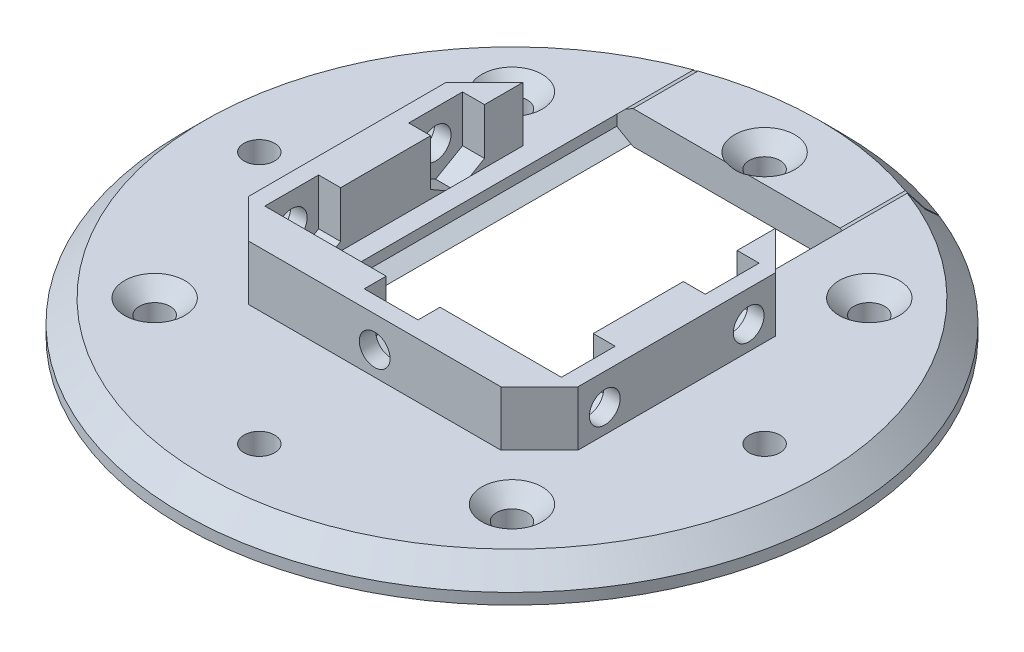
from build123d import *

# Parameters (mm, degrees)
SKETCH1_R                                      = 30
BOSS_EXTRUDE1_DEPTH                            = 1.5
CUT_EXTRUDE1_DEPTH                             = 43.532340636
BOSS_EXTRUDE2_REACH                            = 48.465
BOSS_EXTRUDE2_END_RADIUS                       = 30
CHAMFER1_SIZE                                  = 2
BOSS_EXTRUDE3_REACH                            = 60.715
BOSS_EXTRUDE3_END_RADIUS                       = 30
CHAMFER2_SIZE                                  = 2
SKETCH5_R                                      = 1.4
CUT_EXTRUDE2_DEPTH                             = 43.532340636
CSK_FOR_M2_5_FLAT_HEAD_MACHINE_SCREW1_AT_COUNT = 2
CSK_FOR_M2_5_FLAT_HEAD_MACHINE_SCREW1_AT_PITCH = 32.526911935
CSK_FOR_M2_5_FLAT_HEAD_MACHINE_SCREW_2_COUNT   = 2
CSK_FOR_M2_5_FLAT_HEAD_MACHINE_SCREW_2_PITCH   = 32.526911935
CSK_FOR_M2_5_FLAT_HEAD_MACHINE_SCREW_3_COUNT   = 2
CSK_FOR_M2_5_FLAT_HEAD_MACHINE_SCREW_3_PITCH   = 46
CSK_FOR_M2_5_FLAT_HEAD_MACHINE_SCREW_4_COUNT   = 2
CSK_FOR_M2_5_FLAT_HEAD_MACHINE_SCREW_4_PITCH   = 42.498458496
BOSS_EXTRUDE4_DEPTH                            = 5
CUT_EXTRUDE3_DEPTH                             = 2
CHAMFER3_SIZE                                  = 3.5
CUT_EXTRUDE4_DEPTH                             = 2
SKETCH13_R                                     = 1.4
CUT_EXTRUDE5_DEPTH                             = 2
CUT_EXTRUDE6_DEPTH                             = 55.472470111
CUT_EXTRUDE6_DEPTH_BACK                        = 55.472470111
SKETCH14_R                                     = 1.4


# Some blends are built 0.0001 mm under size
with BuildPart() as part:
    # Sketch1 → Boss-Extrude1 (new, symmetric)
    with BuildSketch(Plane(origin=(0, 0, 0), x_dir=(1, 0, 0), z_dir=(0, 1, 0))):
        with Locations(Location((0, 0, 0), (0, 0, 270))):
            Circle(SKETCH1_R)
    extrude(amount=BOSS_EXTRUDE1_DEPTH, both=True)

    # Sketch2 → Cut-Extrude1 (cut, through all)
    with BuildSketch(Plane(origin=(0, 1.5, 0), x_dir=(1, 0, 0), z_dir=(0, 1, 0))):
        Polygon((-11.025, 7.55), (-11.025, 30), (11.025, 30), (11.025, 7.55), (11.025, -7.55), (-11.025, -7.55), align=None)
    extrude(amount=-CUT_EXTRUDE1_DEPTH, mode=Mode.SUBTRACT)

    # Boss-Extrude2: up to this cylinder (the profile starts inside it)
    boss_extrude2_end = Plane(origin=(0, -0.7325095, 0), z_dir=(0, -1, 0)) * Cylinder(BOSS_EXTRUDE2_END_RADIUS, 159.395019, mode=Mode.PRIVATE)
    # Sketch3 → Boss-Extrude2 (add, up to the surface)
    with BuildSketch(Plane(origin=(0, 0, 7.55), x_dir=(-1, 0, 0), z_dir=(0, 0, -1)), mode=Mode.PRIVATE) as boss_extrude2_sk1:
        Polygon((-11.525, -1.5), (-9.725961894, -1.5), (-11.025, -0.75), (-11.025, 0.75), (-9.725961894, 1.5), (-11.525, 1.5), align=None)
    boss_extrude2_tool1 = extrude(boss_extrude2_sk1.sketch, amount=BOSS_EXTRUDE2_REACH, mode=Mode.PRIVATE) & boss_extrude2_end
    add(boss_extrude2_tool1.solids().sort_by_distance((10.625481, -1.465019, 7.55))[0])
    # Sketch3 → Boss-Extrude2 (add, up to the surface)
    with BuildSketch(Plane(origin=(0, 0, 7.55), x_dir=(-1, 0, 0), z_dir=(0, 0, -1)), mode=Mode.PRIVATE) as boss_extrude2_sk2:
        Polygon((11.525, 1.5), (11.525, -1.5), (9.725961894, -1.5), (11.025, -0.75), (11.025, 0.75), (9.725961894, 1.5), align=None)
    boss_extrude2_tool2 = extrude(boss_extrude2_sk2.sketch, amount=BOSS_EXTRUDE2_REACH, mode=Mode.PRIVATE) & boss_extrude2_end
    add(boss_extrude2_tool2.solids().sort_by_distance((-11.490019, 0, 7.55))[0])

    # Chamfer1
    chamfer1_edges = [part.edges().sort_by_distance(p)[0] for p in [
        (0, 1.5, 30),
    ]]
    chamfer(chamfer1_edges, length=CHAMFER1_SIZE)


with BuildPart() as body_2:
    # Boss-Extrude3: up to this cylinder (the profile starts inside it)
    boss_extrude3_end = Plane(origin=(0, 0, 0), z_dir=(0, -1, 0)) * Cylinder(BOSS_EXTRUDE3_END_RADIUS, 182.43, mode=Mode.PRIVATE)
    # Sketch6 → Boss-Extrude3 (new, up to the surface)
    with BuildSketch(Plane(origin=(0, 0, -20.45), x_dir=(-1, 0, 0), z_dir=(0, 0, -1)), mode=Mode.PRIVATE) as boss_extrude3_sk1:
        Polygon((9.425961894, -1.5), (-9.425961894, -1.5), (-10.875, -0.66339746), (-10.875, 0.66339746), (-9.425961894, 1.5), (9.425961894, 1.5), (10.875, 0.66339746), (10.875, -0.66339746), align=None)
    boss_extrude3_tool1 = extrude(boss_extrude3_sk1.sketch, amount=BOSS_EXTRUDE3_REACH, mode=Mode.PRIVATE) & boss_extrude3_end
    add(boss_extrude3_tool1.solids().sort_by_distance((0, 0, -20.45))[0])

    # Chamfer2
    # the kernel refuses this chamfer: 2 mm, written as the material it takes off along each edge
    with BuildSketch(Plane(origin=(0, 1.5, 0), x_dir=(-0.47156923659159816, 0, -0.881829039610523), z_dir=(-0.881829039610523, 0, 0.47156923659159816))) as chamfer2_piece_1:
        Polygon((30 - CHAMFER2_SIZE, 0), (30, CHAMFER2_SIZE), (30, 0), align=None)
    revolve(axis=Axis((0, 1.5, 0), (0, -1, 0)), revolution_arc=56.272414757, mode=Mode.SUBTRACT)


with BuildPart() as cut_extrude2_tool:
    # Sketch5 → Cut-Extrude2 (new, through all)
    with BuildSketch(Plane(origin=(0, 1.5, 0), x_dir=(1, 0, 0), z_dir=(0, 1, 0))):
        with Locations(Location((0, 23, 0), (0, 0, 270))):
            Circle(SKETCH5_R)
        with Locations(Location((16.263455967, 16.263455967, 0), (0, 0, 270))):
            Circle(SKETCH5_R)
        with Locations(Location((23, 0, 0), (0, 0, 270))):
            Circle(SKETCH5_R)
        with Locations(Location((16.263455967, -16.263455967, 0), (0, 0, 270))):
            Circle(SKETCH5_R)
        with Locations(Location((0, -23, 0), (0, 0, 270))):
            Circle(SKETCH5_R)
        with Locations(Location((-16.263455967, -16.263455967, 0), (0, 0, 270))):
            Circle(SKETCH5_R)
        with Locations(Location((-23, 0, 0), (0, 0, 270))):
            Circle(SKETCH5_R)
        with Locations(Location((-16.263455967, 16.263455967, 0), (0, 0, 270))):
            Circle(SKETCH5_R)
    extrude(amount=-CUT_EXTRUDE2_DEPTH)


with BuildPart() as part_1:
    add(part.part)

    # Cut-Extrude2: cut by cut_extrude2_tool
    add(cut_extrude2_tool.part, mode=Mode.SUBTRACT)

    # Sketch8 → CSK for M2.5 Flat Head Machine Screw1 (revolve, cut)
    with BuildSketch(Plane(origin=(-16.263455967, 1.5, 16.263455967), x_dir=(0, 0, 1), z_dir=(1, 0, 0))):
        Polygon((0, 0), (0, 3), (1.35, 3), (1.35, 1.4), (2.75, 0), align=None)
    csk_for_m2_5_flat_head_machine_screw1 = revolve(axis=Axis((-16.263455967, 7.85, 16.263455967), (0, -1, 0)), mode=Mode.SUBTRACT)

    # CSK for M2.5 Flat Head Machine Screw1 at: CSK for M2.5 Flat Head Machine Screw1 ×2
    with Locations(*[(i * CSK_FOR_M2_5_FLAT_HEAD_MACHINE_SCREW1_AT_PITCH, 0, 0) for i in range(1, CSK_FOR_M2_5_FLAT_HEAD_MACHINE_SCREW1_AT_COUNT)]):
        add(csk_for_m2_5_flat_head_machine_screw1, mode=Mode.SUBTRACT)

    # CSK for M2.5 Flat Head Machine Screw 2: CSK for M2.5 Flat Head Machine Screw1 ×2
    with Locations(*[(0, 0, -i * CSK_FOR_M2_5_FLAT_HEAD_MACHINE_SCREW_2_PITCH) for i in range(1, CSK_FOR_M2_5_FLAT_HEAD_MACHINE_SCREW_2_COUNT)]):
        add(csk_for_m2_5_flat_head_machine_screw1, mode=Mode.SUBTRACT)

    # CSK for M2.5 Flat Head Machine Screw 3: CSK for M2.5 Flat Head Machine Screw1 ×2
    with Locations(*[Vector(0.7071067811865626, 0, -0.7071067811865325) * (i * CSK_FOR_M2_5_FLAT_HEAD_MACHINE_SCREW_3_PITCH) for i in range(1, CSK_FOR_M2_5_FLAT_HEAD_MACHINE_SCREW_3_COUNT)]):
        add(csk_for_m2_5_flat_head_machine_screw1, mode=Mode.SUBTRACT)

    # Sketch10 → Boss-Extrude4 (add)
    with BuildSketch(Plane(origin=(0, 1.5, 0), x_dir=(1, 0, 0), z_dir=(0, 1, 0))):
        Polygon((-11.5, -9), (-11.5, 12.5), (-15, 12.5), (-15, -12.5), (15, -12.5), (15, 12.5), (11.5, 12.5), (11.5, -9), align=None)
    extrude(amount=BOSS_EXTRUDE4_DEPTH)

    # Sketch11 → Cut-Extrude3 (cut)
    with BuildSketch(Plane(origin=(0, 0, 9), x_dir=(-1, 0, 0), z_dir=(0, 0, -1))):
        Polygon((-2.45, 5.08549184), (-2.45, 2.256475521), (0, 0.841967362), (2.45, 2.256475521), (2.45, 5.08549184), (2.45, 6.5), (-2.45, 6.5), align=None)
    extrude(amount=-CUT_EXTRUDE3_DEPTH, mode=Mode.SUBTRACT)

    # Chamfer3
    chamfer3_edges = [part_1.edges().sort_by_distance(p)[0] for p in [
        (15, 4, 12.5),
        (-15, 4, 12.5),
        (-15, 4, -12.5),
        (15, 4, -12.5),
    ]]
    chamfer(chamfer3_edges, length=CHAMFER3_SIZE - 0.0001)  # a hair under: the kernel refuses the full size

    # Sketch12 → Cut-Extrude4 (cut)
    with BuildSketch(Plane(origin=(-11.5, 0, 0), x_dir=(0, 0, -1), z_dir=(1, 0, 0))):
        Polygon((-9, 5.08549184), (-9, 6.5), (-4.1, 6.5), (-4.1, 5.08549184), (-4.1, 2.256475521), (-6.55, 0.841967362), (-9, 2.256475521), align=None)
        Polygon((9, 6.5), (4.1, 6.5), (4.1, 5.08549184), (4.1, 2.256475521), (6.55, 0.841967362), (9, 2.256475521), (9, 5.08549184), align=None)
    cut_extrude4 = extrude(amount=-CUT_EXTRUDE4_DEPTH, mode=Mode.SUBTRACT)

    # Mirror1: Cut-Extrude4 across plane
    add(cut_extrude4.mirror(Plane(origin=(0, 0, 0), x_dir=(0, 0, 1), z_dir=(1, 0, 0))), mode=Mode.SUBTRACT)

    # Sketch13 → Cut-Extrude5 (cut)
    with BuildSketch(Plane(origin=(0, 0, 11), x_dir=(-1, 0, 0), z_dir=(0, 0, -1))):
        with Locations((0, 3.670983681)):
            Circle(SKETCH13_R)
    extrude(amount=-CUT_EXTRUDE5_DEPTH, mode=Mode.SUBTRACT)

    # Sketch14 → Cut-Extrude6 (cut, two sides: drawn at the far end of the back side and taken through both)
    with BuildSketch(Plane.ZY.offset(15).offset(-CUT_EXTRUDE6_DEPTH_BACK)):
        with Locations((6.55, 3.670983681)):
            Circle(SKETCH14_R)
        with Locations((-6.55, 3.670983681)):
            Circle(SKETCH14_R)
    extrude(amount=CUT_EXTRUDE6_DEPTH + CUT_EXTRUDE6_DEPTH_BACK, mode=Mode.SUBTRACT)


with BuildPart() as body_2_1:
    add(body_2.part)

    # Cut-Extrude2: cut by cut_extrude2_tool
    add(cut_extrude2_tool.part, mode=Mode.SUBTRACT)

    # CSK for M2.5 Flat Head Machine Screw 4: CSK for M2.5 Flat Head Machine Screw1 ×2
    with Locations(*[Vector(0.38268343236510954, 0, -0.9238795325112786) * (i * CSK_FOR_M2_5_FLAT_HEAD_MACHINE_SCREW_4_PITCH) for i in range(1, CSK_FOR_M2_5_FLAT_HEAD_MACHINE_SCREW_4_COUNT)]):
        add(csk_for_m2_5_flat_head_machine_screw1, mode=Mode.SUBTRACT)


solid = Compound([part_1.part, body_2_1.part])
